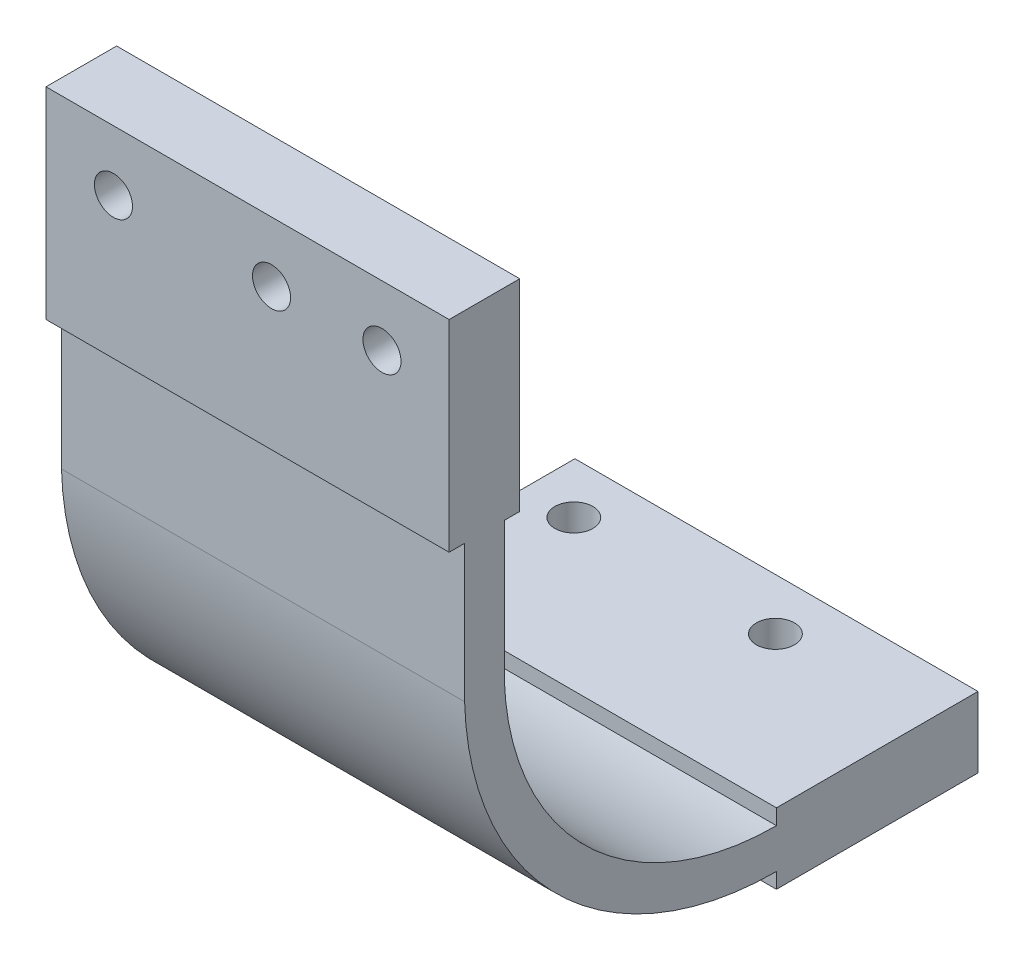
from build123d import *

# Parameters (mm, degrees)
BOSS_EXTRUDE1_DEPTH = 50.8
CUT_EXTRUDE1_REACH  = 113.741
SKETCH2_R           = 2.4
CUT_EXTRUDE2_REACH  = 115.022
SKETCH3_R           = 2.4
LPATTERN1_START     = -8.9
LPATTERN1_OUTLINE_R = 2.4
LPATTERN1_DEPTH     = 8.9


# Read off the part's stored shape, not the designer's step: LPattern1
with BuildPart() as part:
    # Sketch1 → Boss-Extrude1 (new body)
    with BuildSketch(Plane(origin=(0, 0, 0), x_dir=(0, 0, -1), z_dir=(1, 0, 0))):
        with BuildLine():
            Line((0, -25.4), (1.95, -25.4))
            Line((1.95, -25.4), (1.95, -42.683768749))
            ThreePointArc((1.95, -42.683768749), (13.853740865, -69.747329637), (41.25, -80.864))
            Line((41.25, -80.864), (41.25, -82.814))
            Line((41.25, -82.814), (66.65, -82.814))
            Line((66.65, -82.814), (66.65, -73.914))
            Line((66.65, -73.914), (41.25, -73.914))
            Line((41.25, -73.914), (41.25, -75.864))
            ThreePointArc((41.25, -75.864), (17.388850898, -66.211521802), (6.95, -42.683768749))
            Line((6.95, -42.683768749), (6.95, -25.4))
            Line((6.95, -25.4), (8.9, -25.4))
            Line((8.9, -25.4), (8.9, 0))
            Line((8.9, 0), (0, 0))
            Line((0, 0), (0, -25.4))
        make_face()
    extrude(amount=BOSS_EXTRUDE1_DEPTH)

    # Sketch2 → Cut-Extrude1 (cut, up to next)
    with BuildSketch(Plane(origin=(0, -73.914, 0), x_dir=(1, 0, 0), z_dir=(0, 1, 0)), mode=Mode.PRIVATE) as cut_extrude1_sk1:
        with Locations(Location((6.35, 60.17, 0), (0, 0, 270))):
            Circle(SKETCH2_R)
    cut_extrude1_tool1 = extrude(cut_extrude1_sk1.sketch, amount=-CUT_EXTRUDE1_REACH, mode=Mode.PRIVATE) & part.part
    # Sketch2 → Cut-Extrude1 (cut, up to next)
    with BuildSketch(Plane(origin=(0, -73.914, 0), x_dir=(1, 0, 0), z_dir=(0, 1, 0)), mode=Mode.PRIVATE) as cut_extrude1_sk2:
        with Locations(Location((31.75, 60.17, 0), (0, 0, 270))):
            Circle(SKETCH2_R)
    cut_extrude1_tool2 = extrude(cut_extrude1_sk2.sketch, amount=-CUT_EXTRUDE1_REACH, mode=Mode.PRIVATE) & part.part
    add(cut_extrude1_tool1.solids().sort_by_distance((6.35, -73.914, -60.17))[0], mode=Mode.SUBTRACT)
    add(cut_extrude1_tool2.solids().sort_by_distance((31.75, -73.914, -60.17))[0], mode=Mode.SUBTRACT)

    # Sketch3 → Cut-Extrude2 (cut, up to next)
    with BuildSketch(Plane(origin=(0, 0, -8.9), x_dir=(-1, 0, 0), z_dir=(0, 0, -1)), mode=Mode.PRIVATE) as cut_extrude2_sk1:
        with Locations(Location((-42.34, -7.6, 0), (0, 0, 90))):
            Circle(SKETCH3_R)
    cut_extrude2_tool1 = extrude(cut_extrude2_sk1.sketch, amount=-CUT_EXTRUDE2_REACH, mode=Mode.PRIVATE) & part.part
    add(cut_extrude2_tool1.solids().sort_by_distance((42.34, -7.6, -8.9))[0], mode=Mode.SUBTRACT)

    # LPattern1 outline → LPattern1 (cut)
    with BuildSketch(Plane.XY.offset(LPATTERN1_START)):
        with Locations((8.5, -7.6)):
            Circle(LPATTERN1_OUTLINE_R)
        with Locations((28.42, -7.6)):
            Circle(LPATTERN1_OUTLINE_R)
    extrude(amount=LPATTERN1_DEPTH, mode=Mode.SUBTRACT)


solid = part.part
